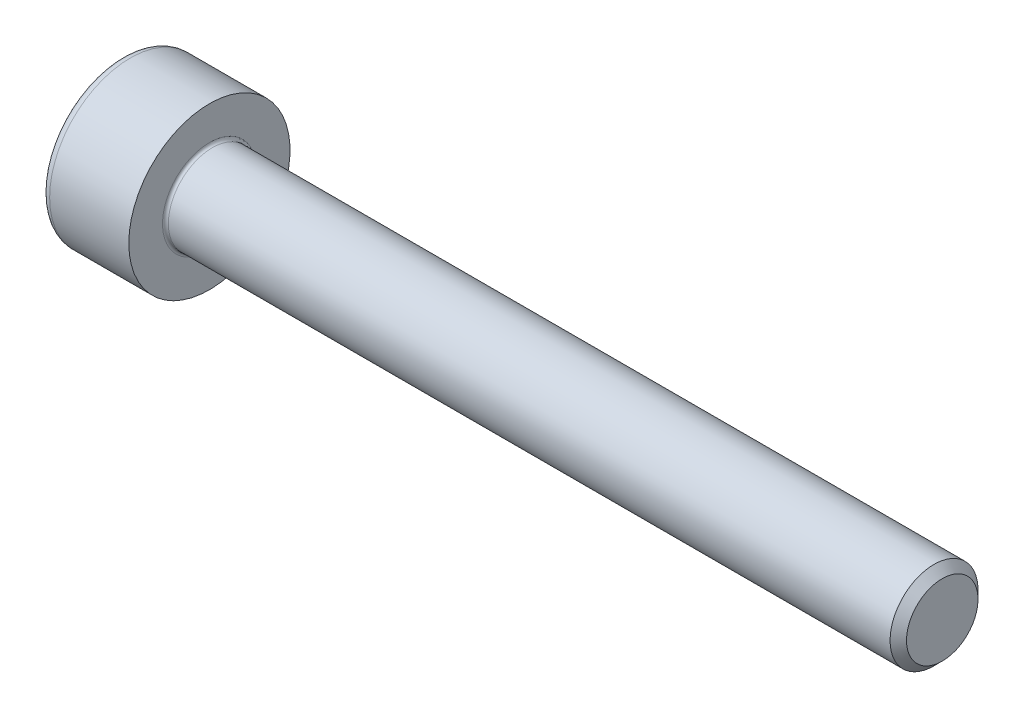
from build123d import *

# Parameters (mm, degrees)
FILLET1_R   = 0.1
FILLET2_R   = 0.3
HEX_2_DEPTH = 1.3


with BuildPart() as part:
    # BodySke → Base-Revolve (revolve)
    with BuildSketch(Plane.XY):
        Polygon((0, 0), (0, 2.75), (3, 2.75), (3, 1.5), (27.7195, 1.5), (28, 1.2195), (28, 0), align=None)
    revolve(axis=Axis((-31.75, 0, 0), (1, 0, 0)))

    # Fillet1
    fillet1_edges = [part.edges().sort_by_distance(p)[0] for p in [
        (3, -1.5, 0),
    ]]
    fillet(fillet1_edges, radius=FILLET1_R)

    # Fillet2
    fillet2_edges = [part.edges().sort_by_distance(p)[0] for p in [
        (0, -2.75, 0),
    ]]
    fillet(fillet2_edges, radius=FILLET2_R)

    # Sketch2 → Hex-PreBroach (revolve, cut)
    with BuildSketch(Plane.XY):
        Polygon((0, 1.26), (1.3, 1.26), (2.027461339, 0), (0, 0), align=None)
    revolve(axis=Axis((0, 0, 0), (1, 0, 0)), mode=Mode.SUBTRACT)

    # Sketch3 → Hex 2 (cut)
    with BuildSketch(Plane(origin=(0, 0, 0), x_dir=(0, 0.500000000000001, 0.866025403784438), z_dir=(-1, 0, 0))):
        Polygon((0.727461339, 1.26), (-0.727461339, 1.26), (-1.454922678, 0), (-0.727461339, -1.26), (0.727461339, -1.26), (1.454922678, 0), align=None)
    extrude(amount=-HEX_2_DEPTH, mode=Mode.SUBTRACT)


solid = part.part
